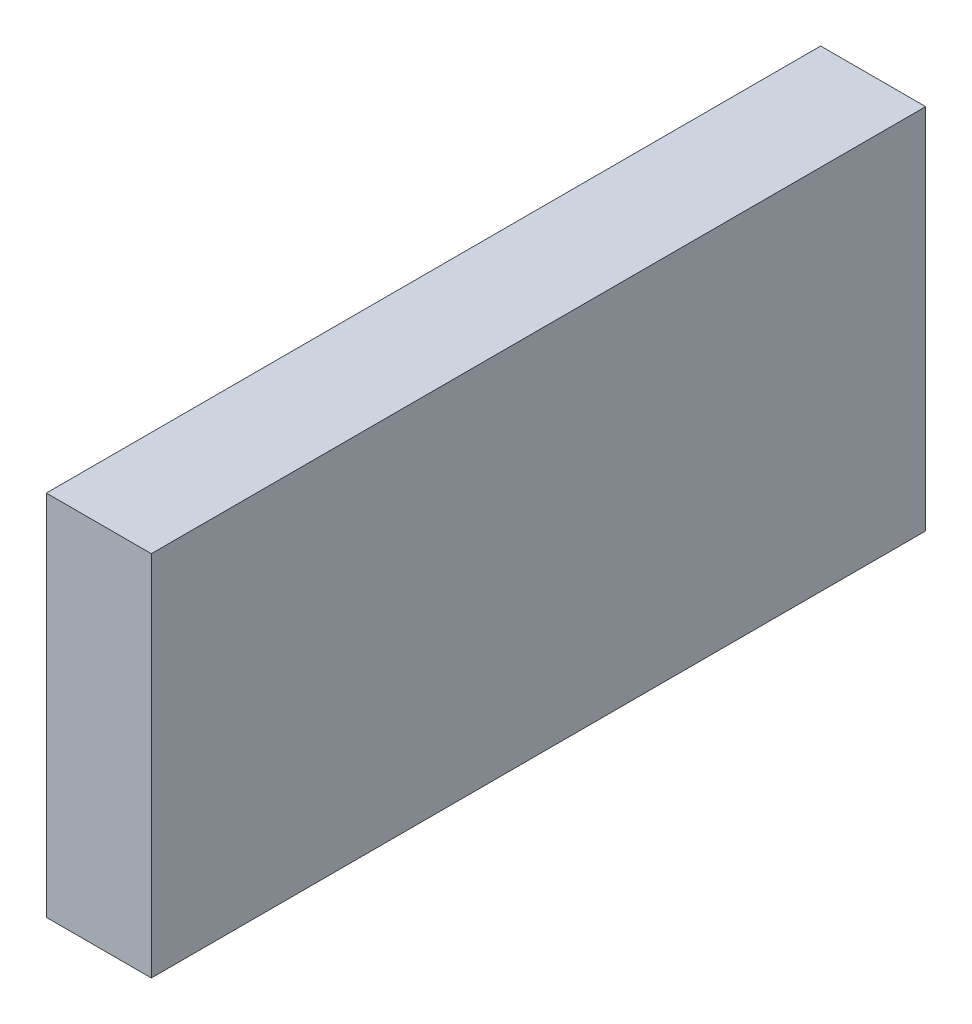
from build123d import *

# Parameters (mm, degrees)
SKETCH1_W           = 295
SKETCH1_H           = 140
BOSS_EXTRUDE1_DEPTH = 40


with BuildPart() as part:
    # Sketch1 → Boss-Extrude1 (new body)
    with BuildSketch(Plane(origin=(0, 0, 0), x_dir=(0, 0, -1), z_dir=(1, 0, 0))):
        Rectangle(SKETCH1_W, SKETCH1_H)
    extrude(amount=BOSS_EXTRUDE1_DEPTH)


solid = part.part
